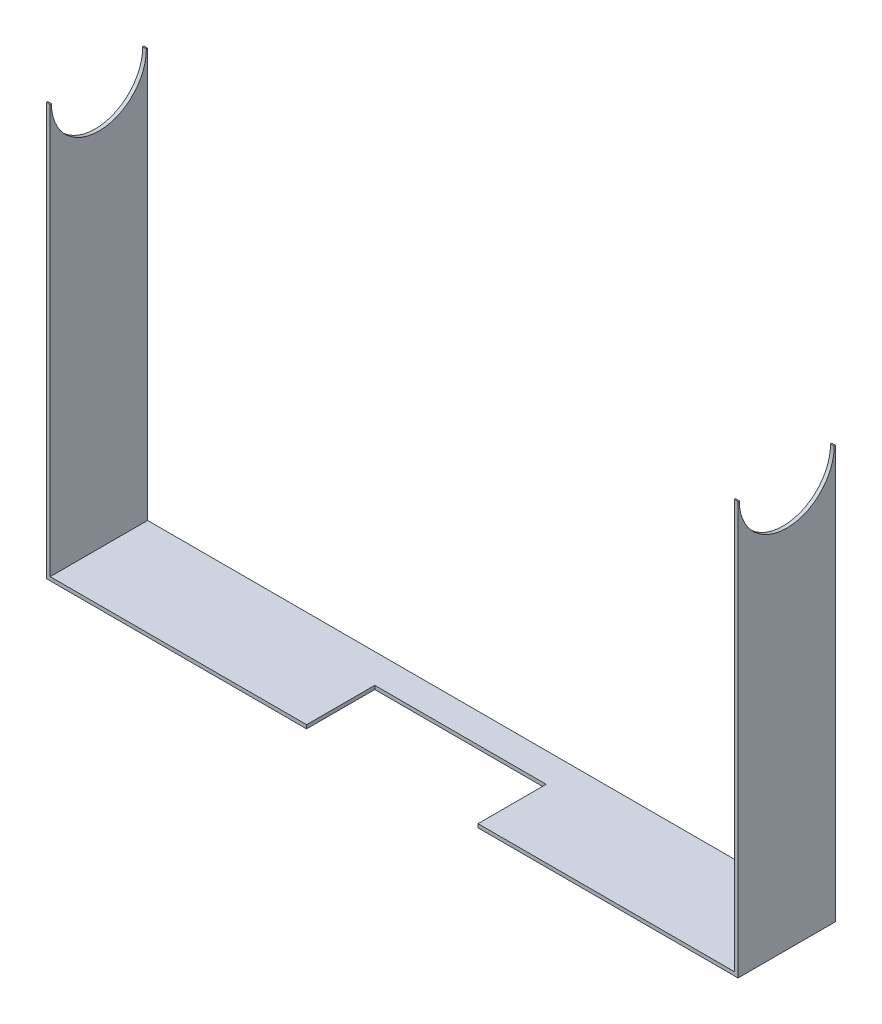
from build123d import *

# Parameters (mm, degrees)
EXTRUDE_1_DEPTH          = 40
CUT_EXTRUDE_1_DEPTH      = 368
CUT_EXTRUDE_1_DEPTH_BACK = 39
SKETCH_2_R               = 19.5
CUT_EXTRUDE_2_DEPTH      = 39


with BuildPart() as part:
    # 草图1 → 凸台-拉伸1 (new body)
    with BuildSketch(Plane.XY):
        Polygon((-52.98729817, 27.74861141), (-52.98729817, -141.75138859), (231.01270183, -141.75138859), (231.01270183, 27.74861141), (229.51270183, 27.74861141), (229.51270183, -140.25138859), (-51.48729817, -140.25138859), (-51.48729817, 27.74861141), align=None)
    extrude(amount=EXTRUDE_1_DEPTH)

    # 草图2 → 切除-拉伸1 (cut, two sides: drawn at the far end of the back side and taken through both)
    with BuildSketch(Plane(origin=(-51.48729817, 0, 0), x_dir=(0, 0, -1), z_dir=(1, 0, 0)).offset(-CUT_EXTRUDE_1_DEPTH_BACK)):
        with Locations((-20, 27.74861141)):
            Circle(SKETCH_2_R)
    extrude(amount=CUT_EXTRUDE_1_DEPTH + CUT_EXTRUDE_1_DEPTH_BACK, mode=Mode.SUBTRACT)

    # 草图4 → 切除-拉伸2 (cut)
    with BuildSketch(Plane(origin=(0, -140.25138859, 0), x_dir=(1, 0, 0), z_dir=(0, 1, 0))):
        Polygon((89.01270183, -40), (53.81270183, -40), (53.81270183, -12), (89.01270183, -12), (124.21270183, -12), (124.21270183, -40), align=None)
    extrude(amount=-CUT_EXTRUDE_2_DEPTH, mode=Mode.SUBTRACT)


solid = part.part
